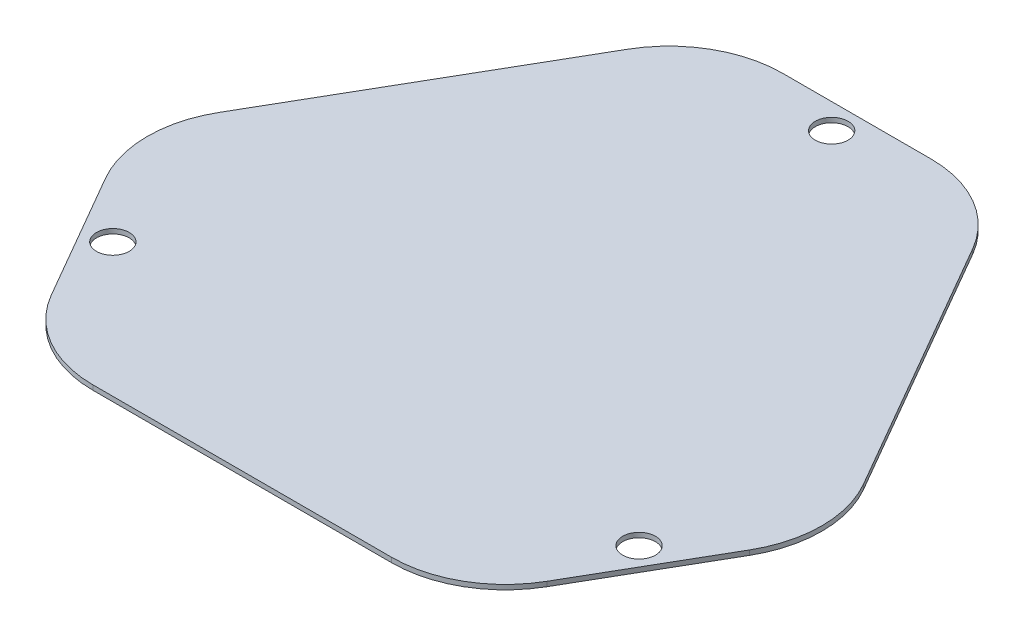
from build123d import *

# Parameters (mm, degrees)
SKETCH3_R           = 21.082
BOSS_EXTRUDE1_DEPTH = 6.35
CUT_EXTRUDE1_DEPTH  = 722.250266796
FILLET1_R           = 152.4
SKETCH5_R           = 21.971
CUT_EXTRUDE2_DEPTH  = 632.548321209


with BuildPart() as part:
    # Sketch3 → Boss-Extrude1 (new body)
    with BuildSketch(Plane(origin=(0, 0, 0), x_dir=(1, 0, 0), z_dir=(0, 1, 0))):
        Polygon((-534.293160191, 43.478424236), (-229.493160191, -484.450661911), (229.493160191, -484.450661911), (534.293160191, 43.478424236), (304.8, 440.972237675), (-304.8, 440.972237675), align=None)
        with Locations((-352.63709, -203.595118838)):
            Circle(SKETCH3_R, mode=Mode.SUBTRACT)
        with Locations((352.63709, -203.595118838)):
            Circle(SKETCH3_R, mode=Mode.SUBTRACT)
        with Locations((0, 407.190237675)):
            Circle(SKETCH3_R, mode=Mode.SUBTRACT)
    extrude(amount=BOSS_EXTRUDE1_DEPTH)

    # Sketch4 → Cut-Extrude1 (cut, through all)
    with BuildSketch(Plane(origin=(0, 6.35, 0), x_dir=(1, 0, 0), z_dir=(0, 1, 0))):
        Polygon((-187.482425301, 440.972237675), (-475.634372841, -58.121575764), (-534.293160191, 43.478424236), (-304.8, 440.972237675), align=None)
        Polygon((304.8, 440.972237675), (534.293160191, 43.478424236), (475.634372841, -58.121575764), (187.482425301, 440.972237675), align=None)
        Polygon((229.493160191, -484.450661911), (-229.493160191, -484.450661911), (-288.15194754, -382.850661911), (288.15194754, -382.850661911), align=None)
    extrude(amount=-CUT_EXTRUDE1_DEPTH, mode=Mode.SUBTRACT)

    # Fillet1
    fillet1_edges = [part.edges().sort_by_distance(p)[0] for p in [
        (475.634372841, 3.175, 58.121575764),
        (187.482425301, 3.175, -440.972237675),
        (-187.482425301, 3.175, -440.972237675),
        (-288.15194754, 3.175, 382.850661911),
        (288.15194754, 3.175, 382.850661911),
        (-475.634372841, 3.175, 58.121575764),
    ]]
    fillet(fillet1_edges, radius=FILLET1_R)

    # Sketch5 → Cut-Extrude2 (cut, through all)
    with BuildSketch(Plane(origin=(0, 6.35, 0), x_dir=(1, 0, 0), z_dir=(0, 1, 0))):
        with Locations((0, 407.190237675)):
            Circle(SKETCH5_R)
        with Locations((352.63709, -203.595118838)):
            Circle(SKETCH5_R)
        with Locations((-352.63709, -203.595118838)):
            Circle(SKETCH5_R)
    extrude(amount=-CUT_EXTRUDE2_DEPTH, mode=Mode.SUBTRACT)


solid = part.part
